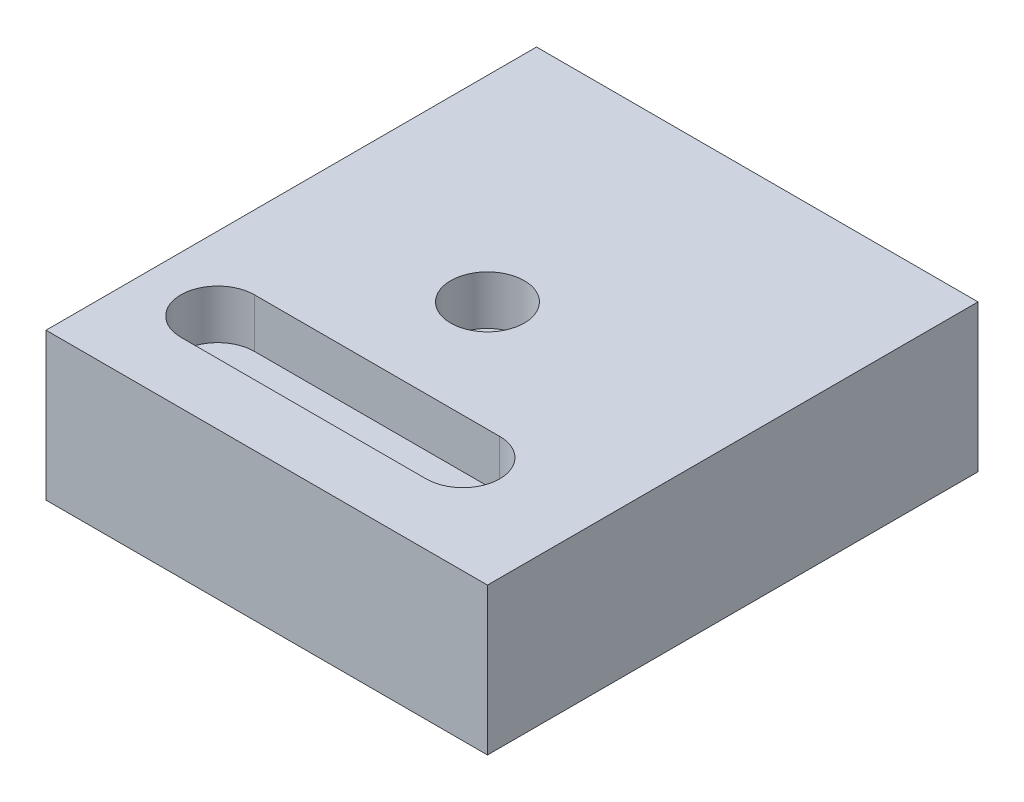
from build123d import *

# Parameters (mm, degrees)
EXTRUDE_1_DEPTH          = 30
SKETCH_1_W               = 100
SKETCH_1_H               = 100
EXTRUDE_1_2_DEPTH        = 30
SKETCH_2_R               = 7.5
CUT_EXTRUDE_2_DEPTH      = 10
CUT_EXTRUDE_3_DEPTH      = 190.208879284
CUT_EXTRUDE_3_DEPTH_BACK = 190.208879284
CUT_EXTRUDE_4_DEPTH      = 116.758369028
CUT_EXTRUDE_4_DEPTH_BACK = 10
SKETCH_5_W               = 100
SKETCH_5_H               = 30


with BuildPart() as part:
    # 草图1 → 凸台-拉伸1 (new body)
    with BuildSketch(Plane(origin=(0, 0, 0), x_dir=(1, 0, 0), z_dir=(0, 1, 0))):
        Polygon((80, -50), (180, -50), (80, 50), align=None)
    extrude(amount=EXTRUDE_1_DEPTH)


with BuildPart() as body_2:
    # 草图1 → Extrude 1 2 (new body)
    with BuildSketch(Plane(origin=(0, 0, 0), x_dir=(1, 0, 0), z_dir=(0, 1, 0))):
        Rectangle(SKETCH_1_W, SKETCH_1_H)
    extrude(amount=EXTRUDE_1_2_DEPTH)

    # 草图2 → 切除-拉伸2 (cut)
    with BuildSketch(Plane(origin=(0, 30, 0), x_dir=(1, 0, 0), z_dir=(0, 1, 0))):
        Circle(SKETCH_2_R)
        with BuildLine():
            Line((-25, -22.5), (25, -22.5))
            ThreePointArc((25, -22.5), (32.5, -30), (25, -37.5))
            Line((25, -37.5), (-25, -37.5))
            ThreePointArc((-25, -37.5), (-32.5, -30), (-25, -22.5))
        make_face()
    extrude(amount=-CUT_EXTRUDE_2_DEPTH, mode=Mode.SUBTRACT)

    # 草图5 → 切除-拉伸4 (cut, two sides: drawn at the far end of the back side and taken through both)
    with BuildSketch(Plane.ZY.offset(50).offset(-CUT_EXTRUDE_4_DEPTH_BACK)):
        with Locations((0, 15)):
            Rectangle(SKETCH_5_W, SKETCH_5_H)
    extrude(amount=CUT_EXTRUDE_4_DEPTH + CUT_EXTRUDE_4_DEPTH_BACK, mode=Mode.SUBTRACT)


with BuildPart() as body_3:
    # 镜向3: mirrored copy
    add(part.part.mirror(Plane(origin=(0, 0, 0), x_dir=(0, 0, 1), z_dir=(1, 0, 0))))


with BuildPart() as cut_extrude_3_tool:
    # 草图3 → 切除-拉伸3 (new, two sides: drawn at the far end of the back side and taken through both)
    with BuildSketch(Plane(origin=(0, 30, 0), x_dir=(1, 0, 0), z_dir=(0, 1, 0)).offset(-CUT_EXTRUDE_3_DEPTH_BACK)):
        Polygon((80, 50), (80, -50), (180, -50), align=None)
        Polygon((-80, -50), (-80, 50), (-180, -50), align=None)
    extrude(amount=CUT_EXTRUDE_3_DEPTH + CUT_EXTRUDE_3_DEPTH_BACK)


with BuildPart() as part_1:
    add(part.part)

    # 切除-拉伸3: cut by cut_extrude_3_tool
    add(cut_extrude_3_tool.part, mode=Mode.SUBTRACT)


with BuildPart() as body_3_1:
    add(body_3.part)

    # 切除-拉伸3: cut by cut_extrude_3_tool
    add(cut_extrude_3_tool.part, mode=Mode.SUBTRACT)


solid = body_2.part
